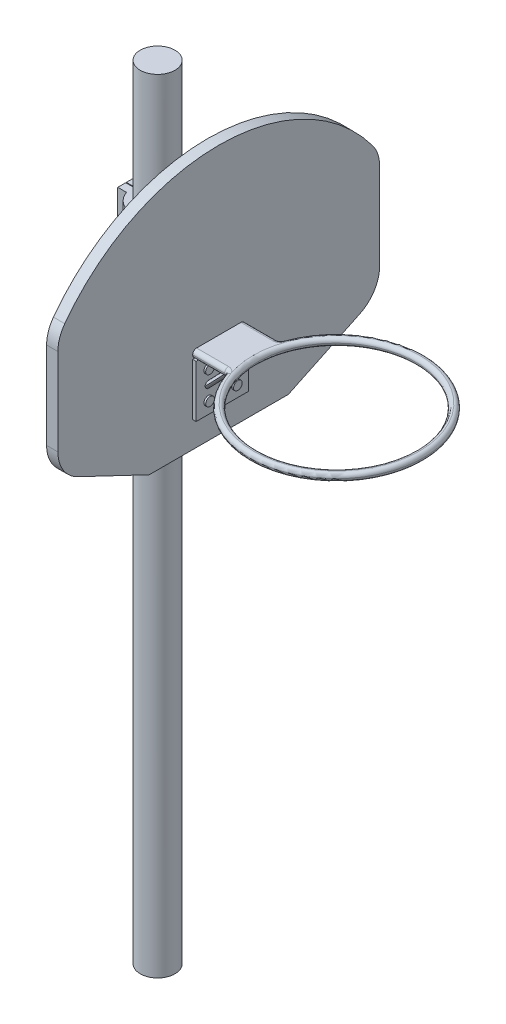
from build123d import *

# Parameters (mm, degrees)
SKETCH1_R            = 12.7
BOSS_EXTRUDE1_DEPTH  = 571.5
BOSS_EXTRUDE2_START  = -38.1
BOSS_EXTRUDE2_DEPTH  = 38.1
BOSS_EXTRUDE3_DEPTH  = 8.255
SKETCH5_W            = 38.1
SKETCH5_H            = 38.1
BOSS_EXTRUDE4_DEPTH  = 2.54
SKETCH6_R            = 3.175
BOSS_EXTRUDE5_DEPTH  = 1.27
SKETCH7_R            = 57.785
BOSS_EXTRUDE7_DEPTH  = 5.715
FILLET2_R            = 2.8575
BOSS_EXTRUDE8_DEPTH  = 2.54
FILLET3_R            = 2.54
FILLET3_OF_MIRROR1_R = 2.54


# Some blends are built 0.0001 mm under size
with BuildPart() as part:
    # Sketch1 → Boss-Extrude1 (new body)
    with BuildSketch(Plane(origin=(0, 0, 0), x_dir=(1, 0, 0), z_dir=(0, 1, 0))):
        with Locations(Location((0, 0, 0), (0, 0, 270))):
            Circle(SKETCH1_R)
    extrude(amount=BOSS_EXTRUDE1_DEPTH)

    # Sketch3 → Boss-Extrude2 (add)
    with BuildSketch(Plane(origin=(0, 482.6, 0), x_dir=(1, 0, 0), z_dir=(0, 1, 0)).offset(BOSS_EXTRUDE2_START)):
        with BuildLine():
            Line((-23.075350333, -6.0325), (-16.725350333, -6.0325))
            ThreePointArc((-16.725350333, -6.0325), (0, -17.78), (16.725350333, -6.0325))
            Line((16.725350333, -6.0325), (29.425350333, -6.0325))
            Line((29.425350333, -6.0325), (29.425350333, -14.2875))
            Line((29.425350333, -14.2875), (36.410350333, -14.2875))
            Line((36.410350333, -14.2875), (36.410350333, -0.254))
            Line((36.410350333, -0.254), (12.697459746, -0.254))
            ThreePointArc((12.697459746, -0.254), (0, -12.7), (-12.697459746, -0.254))
            Line((-12.697459746, -0.254), (-23.075350333, -0.254))
            Line((-23.075350333, -0.254), (-23.075350333, -6.0325))
        make_face()
        with BuildLine():
            Line((-23.075350333, 6.0325), (-16.725350333, 6.0325))
            ThreePointArc((-16.725350333, 6.0325), (0, 17.78), (16.725350333, 6.0325))
            Line((16.725350333, 6.0325), (29.425350333, 6.0325))
            Line((29.425350333, 6.0325), (29.425350333, 14.2875))
            Line((29.425350333, 14.2875), (36.410350333, 14.2875))
            Line((36.410350333, 14.2875), (36.410350333, 0.254))
            Line((36.410350333, 0.254), (12.697459746, 0.254))
            ThreePointArc((12.697459746, 0.254), (0, 12.7), (-12.697459746, 0.254))
            Line((-12.697459746, 0.254), (-23.075350333, 0.254))
            Line((-23.075350333, 0.254), (-23.075350333, 6.0325))
        make_face()
    extrude(amount=BOSS_EXTRUDE2_DEPTH)

    # Sketch4 → Boss-Extrude3 (add)
    with BuildSketch(Plane(origin=(36.410350333, 0, 0), x_dir=(0, 0, -1), z_dir=(1, 0, 0))):
        with BuildLine():
            Line((-117.475, 468.321030155), (-117.475, 404.821030155))
            ThreePointArc((-117.475, 404.821030155), (-113.552150052, 391.26035076), (-102.995312942, 381.888372976))
            Line((-102.995312942, 381.888372976), (-50.8, 357.033462052))
            Line((-50.8, 357.033462052), (50.8, 357.033462052))
            Line((50.8, 357.033462052), (102.995312942, 381.888372976))
            ThreePointArc((102.995312942, 381.888372976), (113.552150052, 391.26035076), (117.475, 404.821030155))
            Line((117.475, 404.821030155), (117.475, 468.321030155))
            ThreePointArc((117.475, 468.321030155), (116.193474785, 476.28715682), (112.478214642, 483.449441581))
            ThreePointArc((112.478214642, 483.449441581), (0, 540.074339402), (-112.478214642, 483.449441581))
            ThreePointArc((-112.478214642, 483.449441581), (-116.193474785, 476.28715682), (-117.475, 468.321030155))
        make_face()
    extrude(amount=BOSS_EXTRUDE3_DEPTH)

    # Sketch5 → Boss-Extrude4 (add)
    with BuildSketch(Plane(origin=(44.665350333, 0, 0), x_dir=(0, 0, -1), z_dir=(1, 0, 0))):
        with Locations((0, 395.133462052)):
            Rectangle(SKETCH5_W, SKETCH5_H)
    extrude(amount=BOSS_EXTRUDE4_DEPTH)

    # Sketch6 → Boss-Extrude5 (add)
    with BuildSketch(Plane(origin=(47.205350333, 0, 0), x_dir=(0, 0, -1), z_dir=(1, 0, 0))):
        with Locations(Location((-10.16, 405.293462052, 0), (0, 0, 180))):
            Circle(SKETCH6_R)
        with Locations(Location((10.16, 405.293462052, 0), (0, 0, 180))):
            Circle(SKETCH6_R)
        with Locations(Location((-10.16, 384.973462052, 0), (0, 0, 180))):
            Circle(SKETCH6_R)
        with Locations(Location((10.16, 384.973462052, 0), (0, 0, 180))):
            Circle(SKETCH6_R)
    extrude(amount=BOSS_EXTRUDE5_DEPTH)



with BuildPart() as body_2:
    # Sketch7 → Boss-Extrude7 (new body)
    with BuildSketch(Plane(origin=(0, 414.183462052, 0), x_dir=(1, 0, 0), z_dir=(0, 1, 0))):
        with BuildLine():
            Line((44.665350333, -19.05), (70.065350333, -19.05))
            ThreePointArc((70.065350333, -19.05), (194.140489623, 0), (70.065350333, 19.05))
            Line((70.065350333, 19.05), (44.665350333, 19.05))
            Line((44.665350333, 19.05), (44.665350333, -19.05))
        make_face()
        with Locations(Location((130.640489623, 0, 0), (0, 0, 270))):
            Circle(SKETCH7_R, mode=Mode.SUBTRACT)
    extrude(amount=BOSS_EXTRUDE7_DEPTH)

    # Fillet2
    fillet2_edges = [body_2.edges().sort_by_distance(p)[0] for p in [
        (70.065350333, 417.040962052, -19.05),
        (70.065350333, 417.040962052, 19.05),
    ]]
    fillet(fillet2_edges, radius=FILLET2_R)
    fillet2_2_edges = [body_2.edges().sort_by_distance(p)[0] for p in [
        (130.640489623, 414.183462052, -57.785),
        (130.640489623, 419.898462052, -57.785),
        (56.334477927, 419.898462052, -19.05),
        (56.334477927, 414.183462052, -19.05),
        (56.334477927, 414.183462052, 19.05),
        (56.334477927, 419.898462052, 19.05),
        (69.657326043, 419.898462052, 19.577153527),
        (69.657326043, 414.183462052, 19.577153527),
        (69.657326043, 414.183462052, -19.577153527),
        (69.657326043, 419.898462052, -19.577153527),
    ]]
    fillet(fillet2_2_edges, radius=FILLET2_R - 0.0001)  # a hair under: the kernel refuses the full size


with BuildPart() as part_1:
    add(part.part)

    add(body_2.part)  # Boss-Extrude8 merges body 2
    # Sketch8 → Boss-Extrude8 (add, symmetric)
    with BuildSketch(Plane(origin=(0, 0, -10.16), x_dir=(-1, 0, 0), z_dir=(0, 0, -1))):
        Polygon((-68.003605521, 414.183462052), (-47.205350333, 392.593462052), (-47.205350333, 397.673462052), (-63.109898418, 414.183462052), align=None)
    boss_extrude8 = extrude(amount=BOSS_EXTRUDE8_DEPTH, both=True)

    # Fillet3
    # the kernel refuses this fillet: 2.54 mm, written as the material it takes off along each edge
    with BuildSketch(Plane(origin=(42.799859116, 393.100263266, -7.62), x_dir=(0, 0, -1), z_dir=(0.6937781444220081, 0.720188785196184, 0))) as fillet3_piece_1_section:
        with BuildLine():
            CenterArc((FILLET3_R, -FILLET3_R), FILLET3_R, 90, 90)
            Line((0, -FILLET3_R), (0, 0))
            Line((0, 0), (FILLET3_R, 0))
        make_face()
    fillet3_piece_1 = extrude(amount=35.624544702, mode=Mode.PRIVATE)
    fillet3_piece_1 = split(fillet3_piece_1, bisect_by=Plane(origin=(55.574161043, 414.183462052, -8.180317928), z_dir=(0, -1, 0)), keep=Keep.TOP, mode=Mode.PRIVATE)
    fillet3_piece_1 = split(fillet3_piece_1, bisect_by=Plane(origin=(47.205350333, 405.496068729, -8.180317928), z_dir=(1, 0, 0)), keep=Keep.TOP, mode=Mode.PRIVATE)
    add(fillet3_piece_1, mode=Mode.SUBTRACT)
    with BuildSketch(Plane(origin=(42.799859116, 393.100263266, -12.7), x_dir=(0.720188785196184, -0.6937781444220081, 0), z_dir=(0.6937781444220081, 0.720188785196184, 0))) as fillet3_piece_2_section:
        with BuildLine():
            CenterArc((FILLET3_R, -FILLET3_R), FILLET3_R, 90, 90)
            Line((0, -FILLET3_R), (0, 0))
            Line((0, 0), (FILLET3_R, 0))
        make_face()
    fillet3_piece_2 = extrude(amount=35.624544702, mode=Mode.PRIVATE)
    fillet3_piece_2 = split(fillet3_piece_2, bisect_by=Plane(origin=(55.574161043, 414.183462052, -12.139682072), z_dir=(0, -1, 0)), keep=Keep.TOP, mode=Mode.PRIVATE)
    fillet3_piece_2 = split(fillet3_piece_2, bisect_by=Plane(origin=(47.205350333, 405.496068729, -12.139682072), z_dir=(1, 0, 0)), keep=Keep.TOP, mode=Mode.PRIVATE)
    add(fillet3_piece_2, mode=Mode.SUBTRACT)
    with BuildSketch(Plane(origin=(72.409096738, 418.756660838, -12.7), x_dir=(-0.7201887851961845, 0.6937781444220077, 0), z_dir=(-0.6937781444220078, -0.7201887851961845, 0))) as fillet3_piece_3_section:
        with BuildLine():
            CenterArc((FILLET3_R, -FILLET3_R), FILLET3_R, 90, 90)
            Line((0, -FILLET3_R), (0, 0))
            Line((0, 0), (FILLET3_R, 0))
        make_face()
    fillet3_piece_3 = extrude(amount=42.678250764, mode=Mode.PRIVATE)
    fillet3_piece_3 = split(fillet3_piece_3, bisect_by=Plane(origin=(57.219699643, 414.183462052, -12.112658138), z_dir=(0, -1, 0)), keep=Keep.TOP, mode=Mode.PRIVATE)
    fillet3_piece_3 = split(fillet3_piece_3, bisect_by=Plane(origin=(47.205350333, 403.787888016, -12.112658138), z_dir=(1, 0, 0)), keep=Keep.TOP, mode=Mode.PRIVATE)
    add(fillet3_piece_3, mode=Mode.SUBTRACT)
    with BuildSketch(Plane(origin=(72.409096738, 418.756660838, -7.62), x_dir=(-0.7201887851961845, 0.6937781444220077, 0), z_dir=(-0.6937781444220078, -0.7201887851961845, 0))) as fillet3_piece_4_section:
        with BuildLine():
            CenterArc((FILLET3_R, FILLET3_R), FILLET3_R, 180, 90)
            Line((0, FILLET3_R), (0, 0))
            Line((0, 0), (FILLET3_R, 0))
        make_face()
    fillet3_piece_4 = extrude(amount=42.678250764, mode=Mode.PRIVATE)
    fillet3_piece_4 = split(fillet3_piece_4, bisect_by=Plane(origin=(57.219699643, 414.183462052, -8.207341862), z_dir=(0, -1, 0)), keep=Keep.TOP, mode=Mode.PRIVATE)
    fillet3_piece_4 = split(fillet3_piece_4, bisect_by=Plane(origin=(47.205350333, 403.787888016, -8.207341862), z_dir=(1, 0, 0)), keep=Keep.TOP, mode=Mode.PRIVATE)
    add(fillet3_piece_4, mode=Mode.SUBTRACT)

    # Mirror1: Boss-Extrude8 across plane
    add(boss_extrude8.mirror(Plane(origin=(0, 0, 0), x_dir=(1, 0, 0), z_dir=(0, 0, -1))))

    # Fillet3 of Mirror1
    # the kernel refuses this fillet: 2.54 mm, written as the material it takes off along each edge
    with BuildSketch(Plane(origin=(42.799859116, 393.100263266, 7.62), x_dir=(0.720188785196184, -0.6937781444220081, 0), z_dir=(0.6937781444220081, 0.720188785196184, 0))) as fillet3_of_mirror1_piece_1_section:
        with BuildLine():
            CenterArc((FILLET3_OF_MIRROR1_R, -FILLET3_OF_MIRROR1_R), FILLET3_OF_MIRROR1_R, 90, 90)
            Line((0, -FILLET3_OF_MIRROR1_R), (0, 0))
            Line((0, 0), (FILLET3_OF_MIRROR1_R, 0))
        make_face()
    fillet3_of_mirror1_piece_1 = extrude(amount=35.624544702, mode=Mode.PRIVATE)
    fillet3_of_mirror1_piece_1 = split(fillet3_of_mirror1_piece_1, bisect_by=Plane(origin=(55.574161043, 414.183462052, 8.180317928), z_dir=(0, -1, 0)), keep=Keep.TOP, mode=Mode.PRIVATE)
    fillet3_of_mirror1_piece_1 = split(fillet3_of_mirror1_piece_1, bisect_by=Plane(origin=(47.205350333, 405.496068729, 8.180317928), z_dir=(1, 0, 0)), keep=Keep.TOP, mode=Mode.PRIVATE)
    add(fillet3_of_mirror1_piece_1, mode=Mode.SUBTRACT)
    with BuildSketch(Plane(origin=(42.799859116, 393.100263266, 12.7), x_dir=(0, 0, -1), z_dir=(0.6937781444220081, 0.720188785196184, 0))) as fillet3_of_mirror1_piece_2_section:
        with BuildLine():
            CenterArc((FILLET3_OF_MIRROR1_R, -FILLET3_OF_MIRROR1_R), FILLET3_OF_MIRROR1_R, 90, 90)
            Line((0, -FILLET3_OF_MIRROR1_R), (0, 0))
            Line((0, 0), (FILLET3_OF_MIRROR1_R, 0))
        make_face()
    fillet3_of_mirror1_piece_2 = extrude(amount=35.624544702, mode=Mode.PRIVATE)
    fillet3_of_mirror1_piece_2 = split(fillet3_of_mirror1_piece_2, bisect_by=Plane(origin=(55.574161043, 414.183462052, 12.139682072), z_dir=(0, -1, 0)), keep=Keep.TOP, mode=Mode.PRIVATE)
    fillet3_of_mirror1_piece_2 = split(fillet3_of_mirror1_piece_2, bisect_by=Plane(origin=(47.205350333, 405.496068729, 12.139682072), z_dir=(1, 0, 0)), keep=Keep.TOP, mode=Mode.PRIVATE)
    add(fillet3_of_mirror1_piece_2, mode=Mode.SUBTRACT)
    with BuildSketch(Plane(origin=(72.409096738, 418.756660838, 12.7), x_dir=(0, 0, -1), z_dir=(-0.6937781444220078, -0.7201887851961845, 0))) as fillet3_of_mirror1_piece_3_section:
        with BuildLine():
            CenterArc((FILLET3_OF_MIRROR1_R, -FILLET3_OF_MIRROR1_R), FILLET3_OF_MIRROR1_R, 90, 90)
            Line((0, -FILLET3_OF_MIRROR1_R), (0, 0))
            Line((0, 0), (FILLET3_OF_MIRROR1_R, 0))
        make_face()
    fillet3_of_mirror1_piece_3 = extrude(amount=42.678250764, mode=Mode.PRIVATE)
    fillet3_of_mirror1_piece_3 = split(fillet3_of_mirror1_piece_3, bisect_by=Plane(origin=(57.219699643, 414.183462052, 12.112658138), z_dir=(0, -1, 0)), keep=Keep.TOP, mode=Mode.PRIVATE)
    fillet3_of_mirror1_piece_3 = split(fillet3_of_mirror1_piece_3, bisect_by=Plane(origin=(47.205350333, 403.787888016, 12.112658138), z_dir=(1, 0, 0)), keep=Keep.TOP, mode=Mode.PRIVATE)
    add(fillet3_of_mirror1_piece_3, mode=Mode.SUBTRACT)
    with BuildSketch(Plane(origin=(72.409096738, 418.756660838, 7.62), x_dir=(0, 0, 1), z_dir=(-0.6937781444220078, -0.7201887851961845, 0))) as fillet3_of_mirror1_piece_4_section:
        with BuildLine():
            CenterArc((FILLET3_OF_MIRROR1_R, FILLET3_OF_MIRROR1_R), FILLET3_OF_MIRROR1_R, 180, 90)
            Line((0, FILLET3_OF_MIRROR1_R), (0, 0))
            Line((0, 0), (FILLET3_OF_MIRROR1_R, 0))
        make_face()
    fillet3_of_mirror1_piece_4 = extrude(amount=42.678250764, mode=Mode.PRIVATE)
    fillet3_of_mirror1_piece_4 = split(fillet3_of_mirror1_piece_4, bisect_by=Plane(origin=(57.219699643, 414.183462052, 8.207341862), z_dir=(0, -1, 0)), keep=Keep.TOP, mode=Mode.PRIVATE)
    fillet3_of_mirror1_piece_4 = split(fillet3_of_mirror1_piece_4, bisect_by=Plane(origin=(47.205350333, 403.787888016, 8.207341862), z_dir=(1, 0, 0)), keep=Keep.TOP, mode=Mode.PRIVATE)
    add(fillet3_of_mirror1_piece_4, mode=Mode.SUBTRACT)


solid = part_1.part
